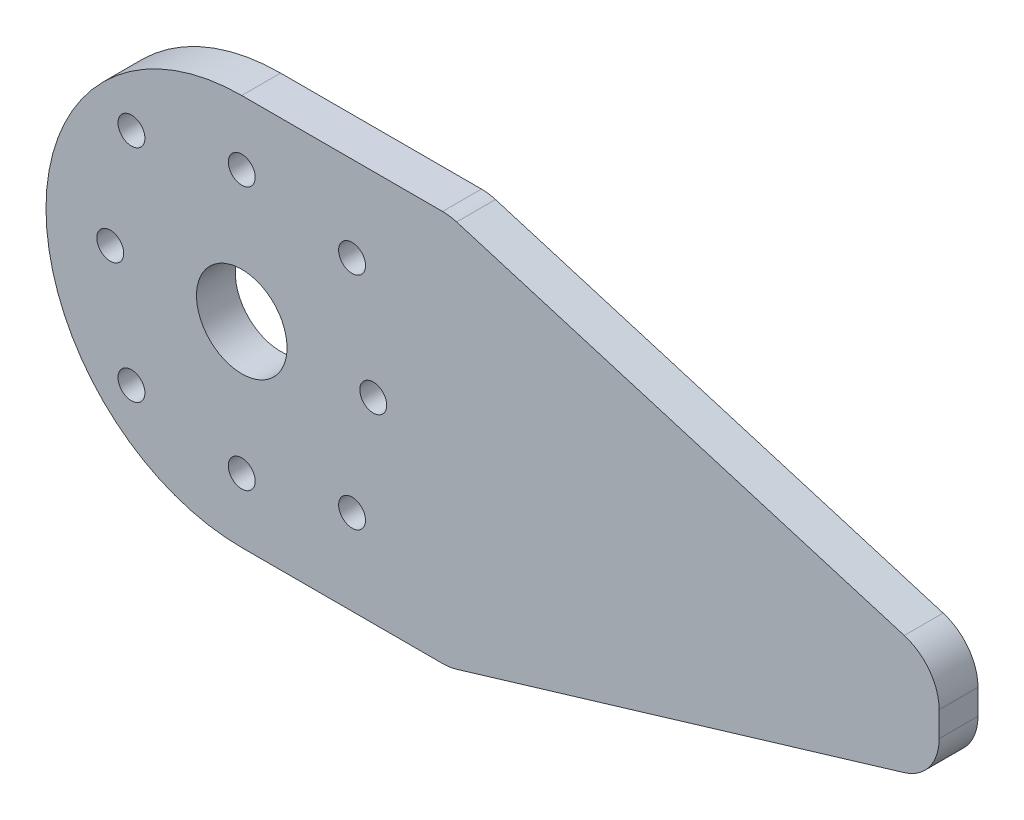
from build123d import *

# Parameters (mm, degrees)
SKETCH1_R           = 1.1
SKETCH1_R_2         = 3.7
BOSS_EXTRUDE1_DEPTH = 3.175
CUT_EXTRUDE1_DEPTH  = 3.175
FILLET1_R           = 4


with BuildPart() as part:
    # Sketch1 → Boss-Extrude1 (new body)
    with BuildSketch(Plane.XY):
        with BuildLine():
            Line((19, 0), (76, 0))
            Line((76, 0), (76, 32))
            Line((76, 32), (19, 32))
            ThreePointArc((19, 32), (3, 16), (19, 0))
        make_face()
        with Locations((8.25, 16)):
            Circle(SKETCH1_R, mode=Mode.SUBTRACT)
        with Locations((9.98438854, 25.01561146)):
            Circle(SKETCH1_R, mode=Mode.SUBTRACT)
        with Locations((28.01561146, 25.01561146)):
            Circle(SKETCH1_R, mode=Mode.SUBTRACT)
        with Locations((28.01561146, 6.98438854)):
            Circle(SKETCH1_R, mode=Mode.SUBTRACT)
        with Locations((9.98438854, 6.98438854)):
            Circle(SKETCH1_R, mode=Mode.SUBTRACT)
        with Locations((19, 26.75)):
            Circle(SKETCH1_R, mode=Mode.SUBTRACT)
        with Locations((29.75, 16)):
            Circle(SKETCH1_R, mode=Mode.SUBTRACT)
        with Locations((19, 5.25)):
            Circle(SKETCH1_R, mode=Mode.SUBTRACT)
        with Locations((19, 16)):
            Circle(SKETCH1_R_2, mode=Mode.SUBTRACT)
    extrude(amount=BOSS_EXTRUDE1_DEPTH)

    # Sketch2 → Cut-Extrude1 (cut)
    with BuildSketch(Plane.XY.offset(3.175)):
        Polygon((76, 32), (76, 20), (36, 32), align=None)
        Polygon((76, 0), (76, 12), (36, 0), align=None)
    extrude(amount=-CUT_EXTRUDE1_DEPTH, mode=Mode.SUBTRACT)

    # Fillet1
    fillet1_edges = [part.edges().sort_by_distance(p)[0] for p in [
        (36, 32, 1.5875),
        (36, 0, 1.5875),
        (76, 20, 1.5875),
        (76, 12, 1.5875),
    ]]
    fillet(fillet1_edges, radius=FILLET1_R)


solid = part.part
